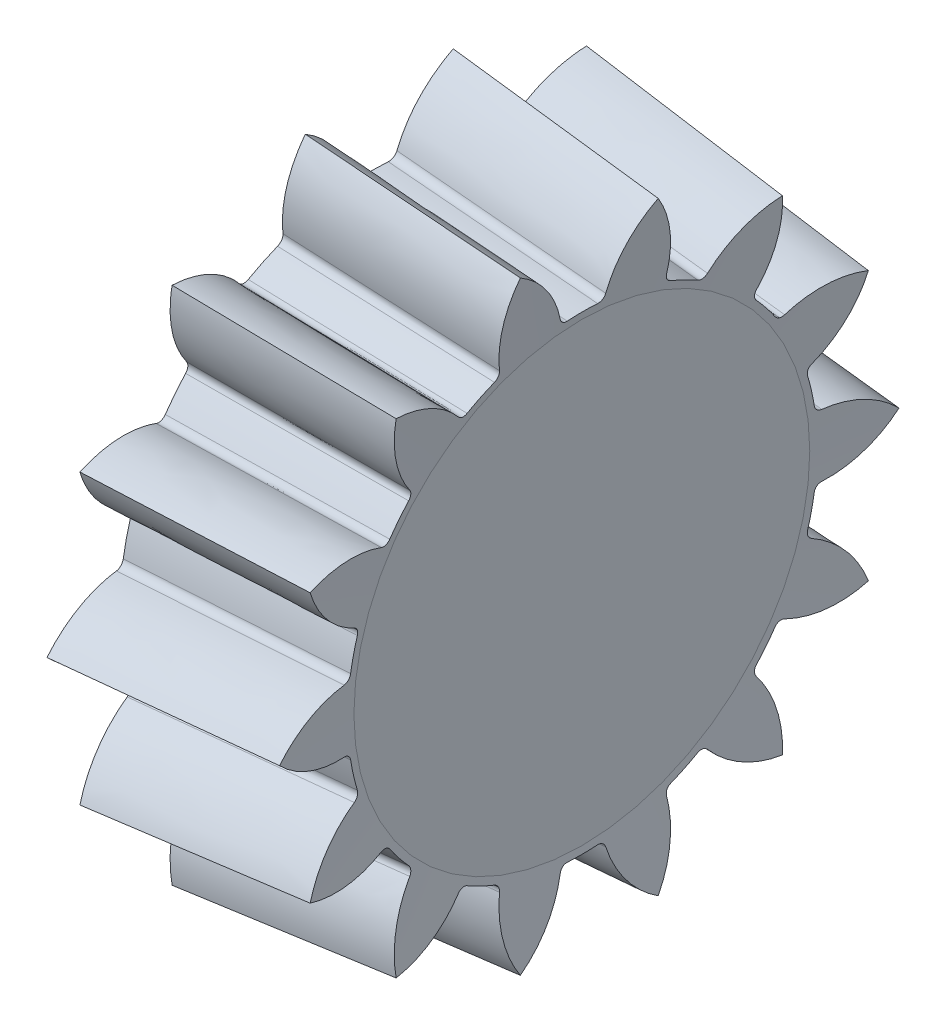
from build123d import *

# Parameters (mm, degrees)
TOOCUTSKE2_R    = 0.0127
TEETHCUTS_COUNT = 14
TEETHCUTS_ANGLE = 334.285714286
SCALE1_SCALE    = 0.358780434


with BuildPart() as part:
    # BasProSke → Base-Revolve (revolve)
    with BuildSketch(Plane(origin=(0, 0, 0), x_dir=(1, 0, 0), z_dir=(0, 1, 0))):
        Polygon((0, 0), (0, 44.125537252), (1.56353657, 61.324439499), (39.44210151, 57.160399083), (37.984731902, 41.129333423), (37.984731902, 0), align=None)
    revolve(axis=Axis((-10, 0, 0), (1, 0, 0)))

    # TooCutSke2 → ToothCut section 0
    with BuildSketch(Plane(origin=(554.821467943, -50.438315325, 0), x_dir=(0, 0, 1), z_dir=(-0.9958932064583257, 0.09053574614567916, 0))):
        with Locations((0, 50.646309203)):
            Circle(TOOCUTSKE2_R)
    # TooCutSke → ToothCut section 1
    with BuildSketch(Plane(origin=(0.781768285, 52.724988375, 0), x_dir=(0, 0, -1), z_dir=(-0.9958932064583256, 0.09053574614567923, 0))):
        with BuildLine():
            ThreePointArc((-16.925695098, -7.530490553), (0, -9.862269717), (16.925695098, -7.530490553))
            ThreePointArc((16.925695098, -7.530490553), (8.97351138, -2.122268375), (4.398817692, 6.336943803))
            ThreePointArc((4.398817692, 6.336943803), (3.857653973, 7.12540115), (2.938576808, 7.389636506))
            ThreePointArc((2.938576808, 7.389636506), (0, 7.294515643), (-2.938576808, 7.389636506))
            ThreePointArc((-2.938576808, 7.389636506), (-3.857653973, 7.12540115), (-4.398817692, 6.336943803))
            ThreePointArc((-4.398817692, 6.336943803), (-8.97351138, -2.122268375), (-16.925695098, -7.530490553))
        make_face()
    toothcut = loft(mode=Mode.SUBTRACT)

    # TeethCuts: ToothCut ×14 about axis
    teethcuts_axis = Axis((-10, 0, 0), (1, 0, 0))
    for i in range(1, TEETHCUTS_COUNT):
        add(toothcut.rotate(teethcuts_axis, i * TEETHCUTS_ANGLE / (TEETHCUTS_COUNT - 1)), mode=Mode.SUBTRACT)


with BuildPart() as part_1:
    # Scale1: scaled about (0, 0, 0)
    add(part.part.scale(SCALE1_SCALE))


solid = part_1.part
